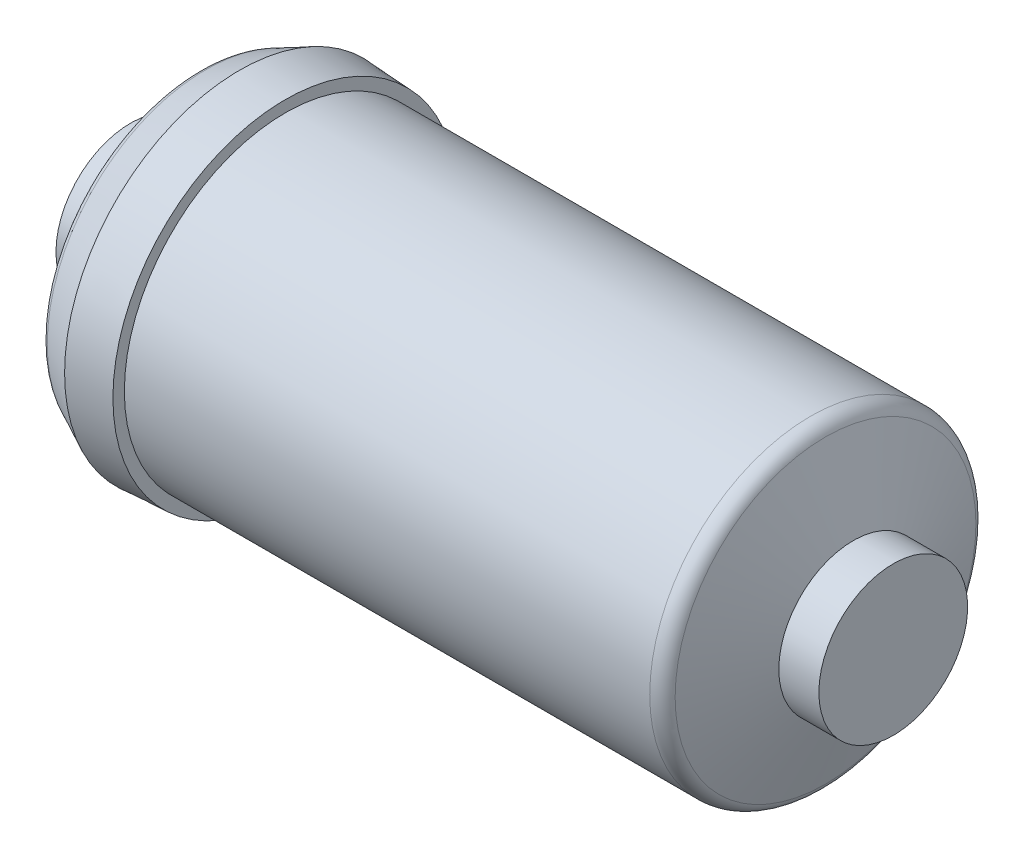
from build123d import *

# Parameters (mm, degrees)
FILLET1_R = 3.175


with BuildPart() as part:
    # Sketch1 → Revolve1 (revolve)
    with BuildSketch(Plane.XY):
        Polygon((0, 0), (0, 14.859), (8.001, 14.859), (13.917700128, 31.115), (21.791700128, 34.925), (30.935700128, 34.417), (30.935700128, 32.131), (138.112506114, 32.131), (144.399, 14.859), (152.4, 14.859), (152.4, 0), align=None)
    revolve(axis=Axis((0, 0, 0), (1, 0, 0)))

    # Fillet1
    fillet1_edges = [part.edges().sort_by_distance(p)[0] for p in [
        (138.112506114, -32.131, 0),
        (13.917700128, -31.115, 0),
    ]]
    fillet(fillet1_edges, radius=FILLET1_R)


solid = part.part
